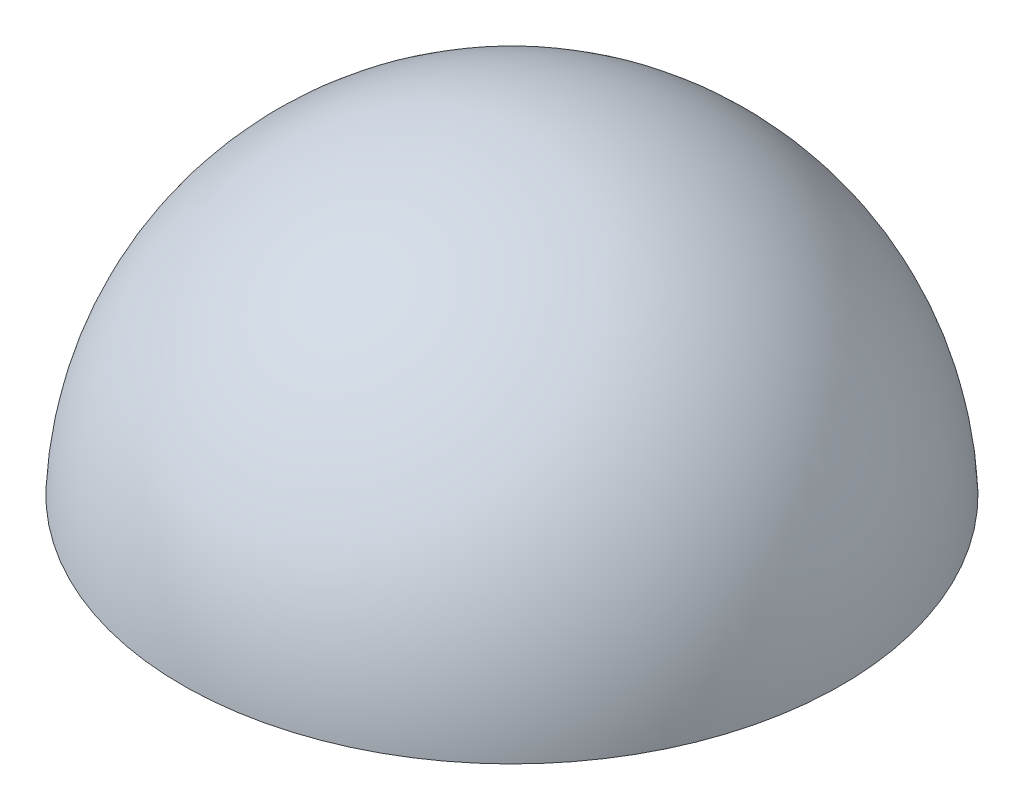
from build123d import *

# Parameters (mm, degrees)
CUT_EXTRUDE1_DEPTH      = 77.989658397
CUT_EXTRUDE1_DEPTH_BACK = 77.989658397
SKETCH2_W               = 118.25599312
SKETCH2_H               = 2.05


# Read off the part's stored shape, not the designer's step: Revolve1
with BuildPart() as part:
    # Revolve1 outline → Revolve1 (revolve)
    with BuildSketch(Plane.XY):
        with BuildLine():
            ThreePointArc((0, 42.45), (30.016682876, 30.016682846), (42.45, -4.2e-08))
            Line((42.45, -4.2e-08), (44.45, -3.3e-08))
            ThreePointArc((44.45, -3.3e-08), (31.430896435, 31.430896412), (0, 44.45))
            Line((0, 44.45), (0, 42.45))
        make_face()
    revolve(axis=Axis((0, 0, 0), (0, 1, 0)))

    # Sketch2 → Cut-Extrude1 (cut, two sides: drawn at the far end of the back side and taken through both)
    with BuildSketch(Plane.XY.offset(-CUT_EXTRUDE1_DEPTH_BACK)):
        with Locations((0, 1.025)):
            Rectangle(SKETCH2_W, SKETCH2_H)
    extrude(amount=CUT_EXTRUDE1_DEPTH + CUT_EXTRUDE1_DEPTH_BACK, mode=Mode.SUBTRACT)


solid = part.part
